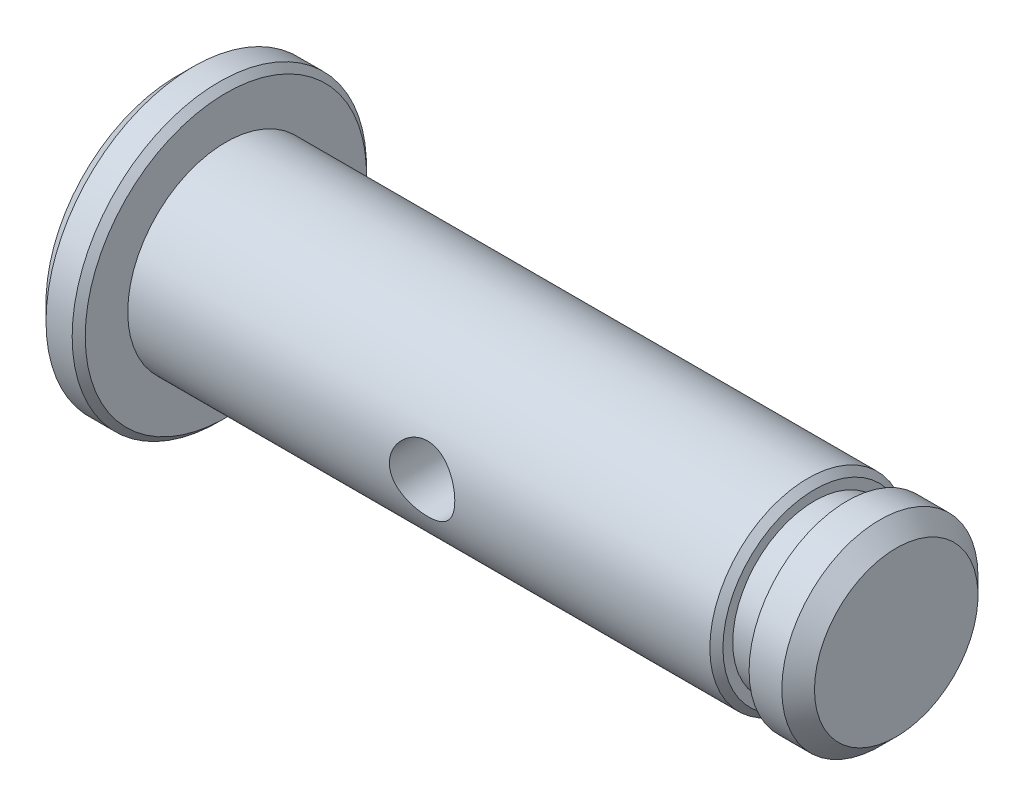
from build123d import *

# Parameters (mm, degrees)
CHAMFER_1_SIZE      = 0.5
SKETCH_2_R          = 1
CUT_EXTRUDE_1_DEPTH = 15
CHAMFER_2_SIZE      = 0.2


with BuildPart() as part:
    # 草图1 → 旋转1 (revolve)
    with BuildSketch(Plane.XY):
        Polygon((0, 0), (0, 4.5), (1.5, 4.5), (1.5, 3), (19.5, 3), (19.5, 2.5), (20.5, 2.5), (20.5, 3), (22, 3), (22, 0), align=None)
    revolve(axis=Axis((0, 0, 0), (1, 0, 0)))

    # 倒角1
    chamfer_1_edges = [part.edges().sort_by_distance(p)[0] for p in [
        (22, -3, 0),
        (0, -4.5, 0),
    ]]
    chamfer(chamfer_1_edges, length=CHAMFER_1_SIZE)

    # 草图2 → 切除-拉伸1 (cut, symmetric)
    with BuildSketch(Plane.XY):
        with Locations((10.5, 0)):
            Circle(SKETCH_2_R)
    extrude(amount=CUT_EXTRUDE_1_DEPTH, both=True, mode=Mode.SUBTRACT)

    # 倒角2
    chamfer_2_edges = [part.edges().sort_by_distance(p)[0] for p in [
        (19.5, -3, 0),
        (1.5, -4.5, 0),
    ]]
    chamfer(chamfer_2_edges, length=CHAMFER_2_SIZE)


solid = part.part
